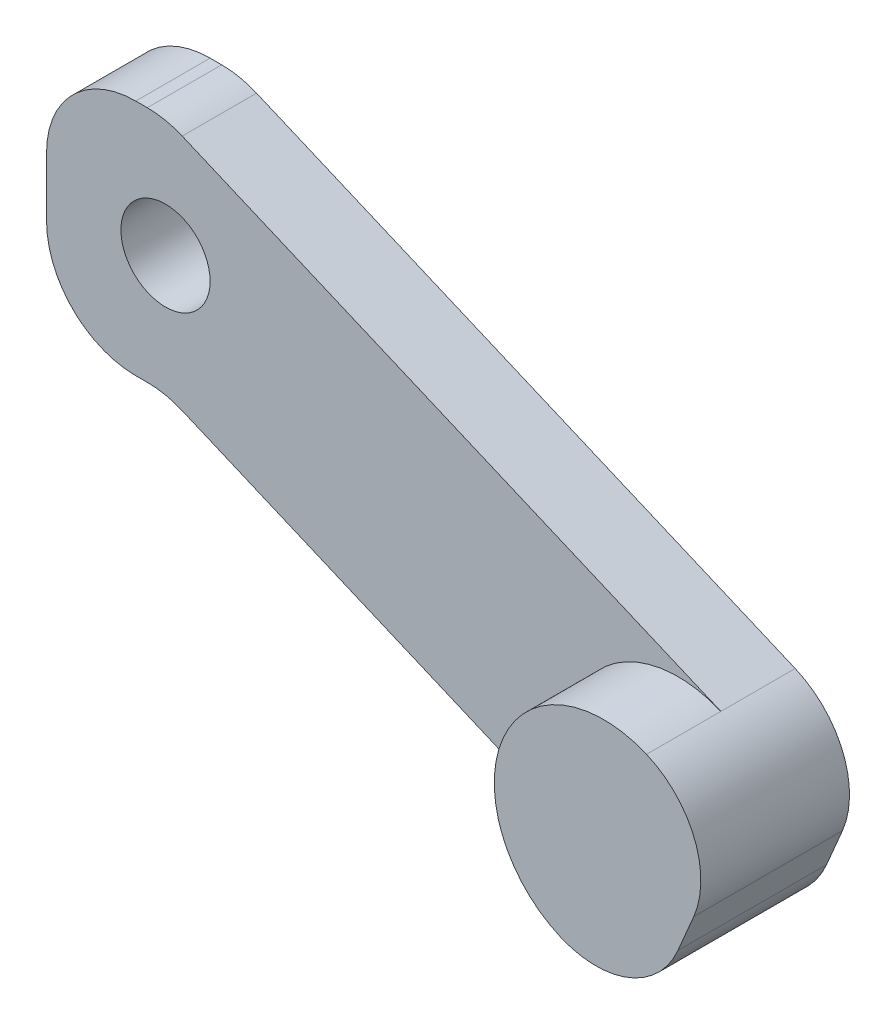
from build123d import *

# Parameters (mm, degrees)
ESBO_O1_R                = 3
RESSALTO_EXTRUS_O1_DEPTH = 5
FILETE1_R                = 6
RESSALTO_EXTRUS_O2_START = 5
RESSALTO_EXTRUS_O2_DEPTH = 5


with BuildPart() as part:
    # Esboço1 → Ressalto-extrusão1 (new body)
    with BuildSketch(Plane.XY):
        Polygon((-8, -8), (-8, 8), (0, 8), (42.879830598, -10.223928004), (37.120169402, -23.776071996), (0, -8), align=None)
        Circle(ESBO_O1_R, mode=Mode.SUBTRACT)
    extrude(amount=RESSALTO_EXTRUS_O1_DEPTH)

    # Filete1
    filete1_edges = [part.edges().sort_by_distance(p)[0] for p in [
        (0, -8, 2.5),
        (-8, -8, 2.5),
        (-8, 8, 2.5),
        (0, 8, 2.5),
        (42.879830598, -10.223928004, 2.5),
        (37.120169402, -23.776071996, 2.5),
    ]]
    fillet(filete1_edges, radius=FILETE1_R)

    # Esboço2 → Ressalto-extrusão2 (add)
    with BuildSketch(Plane.XY.offset(5).offset(RESSALTO_EXTRUS_O2_START)):
        with BuildLine():
            Line((39.467013244, -18.254086485), (40.532986756, -15.745913515))
            ThreePointArc((40.532986756, -15.745913515), (40.575103841, -11.153905468), (37.357845087, -7.877084162))
            ThreePointArc((37.357845087, -7.877084162), (36.552086472, -7.588681558), (35.718304651, -7.395728495))
            ThreePointArc((35.718304651, -7.395728495), (27.413539889, -12.579084175), (31.598183891, -21.429228154))
            ThreePointArc((31.598183891, -21.429228154), (36.190191938, -21.471345238), (39.467013244, -18.254086485))
        make_face()
    extrude(amount=-RESSALTO_EXTRUS_O2_DEPTH)


solid = part.part
